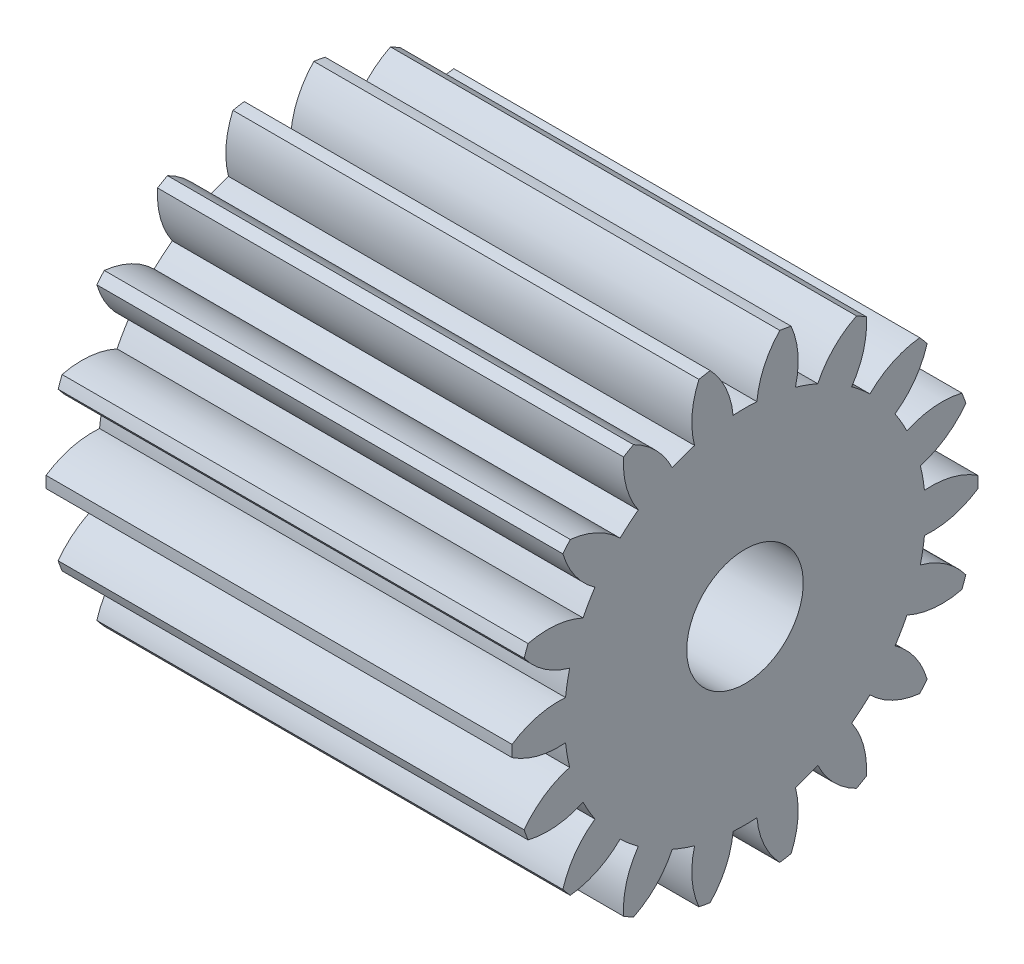
from build123d import *

# Parameters (mm, degrees)
BASPROSKE_W     = 10
BASPROSKE_H     = 5
TOOTHCUT_DEPTH  = 13.247448714
TEETHCUTS_COUNT = 18
TEETHCUTS_ANGLE = 340
BORSKE_R        = 1.25
BORE_DEPTH      = 50.0000508


with BuildPart() as part:
    # BasProSke → Base-Revolve (revolve)
    with BuildSketch(Plane(origin=(0, 0, 0), x_dir=(1, 0, 0), z_dir=(0, 1, 0))):
        with Locations((5, 2.5)):
            Rectangle(BASPROSKE_W, BASPROSKE_H)
    revolve(axis=Axis((-10, 0, 0), (1, 0, 0)))

    # TooCutSke → ToothCut (cut, through all)
    with BuildSketch(Plane(origin=(0, 0, 0), x_dir=(0, 0, -1), z_dir=(1, 0, 0))):
        with BuildLine():
            ThreePointArc((0.25527463, 3.865580275), (0, 3.874), (-0.25527463, 3.865580275))
            ThreePointArc((-0.25527463, 3.865580275), (-0.416281865, 4.46052923), (-0.768562654, 4.96628197))
            ThreePointArc((-0.768562654, 4.96628197), (0, 5.0254), (0.768562654, 4.96628197))
            ThreePointArc((0.768562654, 4.96628197), (0.416281865, 4.46052923), (0.25527463, 3.865580275))
        make_face()
    toothcut = extrude(amount=TOOTHCUT_DEPTH, mode=Mode.SUBTRACT)

    # TeethCuts: ToothCut ×18 about axis
    teethcuts_axis = Axis((-10, 0, 0), (1, 0, 0))
    for i in range(1, TEETHCUTS_COUNT):
        add(toothcut.rotate(teethcuts_axis, i * TEETHCUTS_ANGLE / (TEETHCUTS_COUNT - 1)), mode=Mode.SUBTRACT)

    # BorSke → Bore (cut, symmetric)
    with BuildSketch(Plane(origin=(0, 0, 0), x_dir=(0, 0, -1), z_dir=(1, 0, 0))):
        Circle(BORSKE_R)
    extrude(amount=BORE_DEPTH, both=True, mode=Mode.SUBTRACT)


solid = part.part
